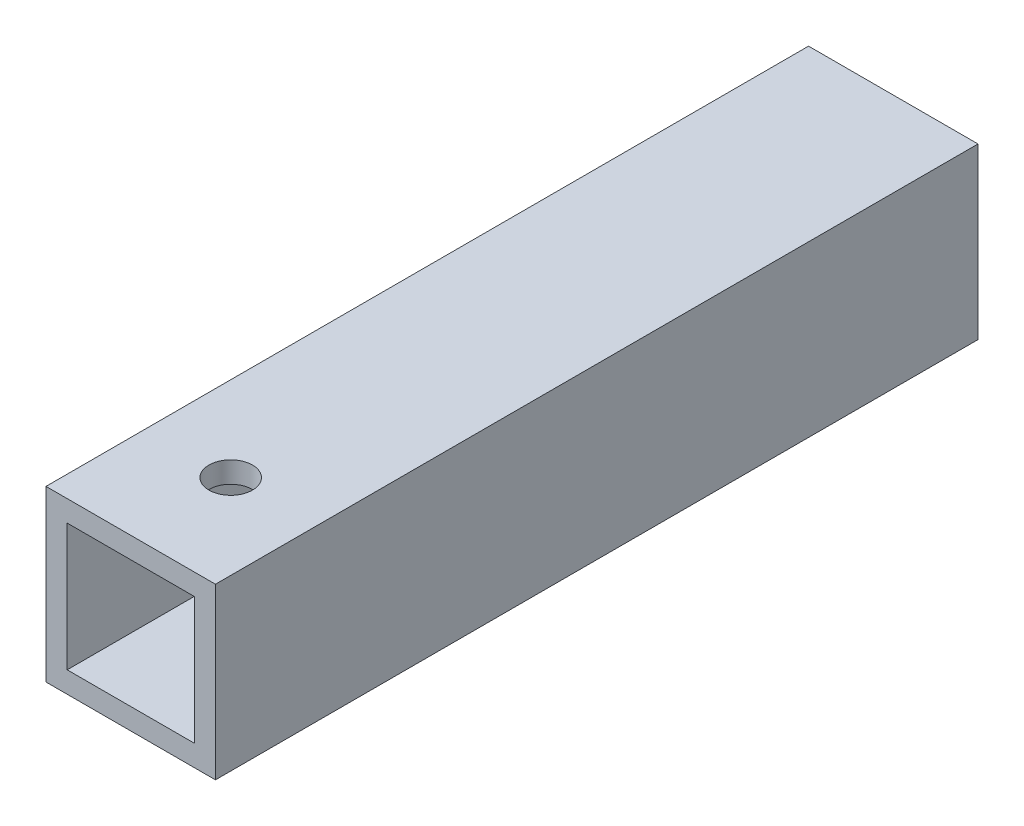
from build123d import *

# Parameters (mm, degrees)
SKETCH1_W           = 25.4
SKETCH1_H           = 25.4
BOSS_EXTRUDE1_DEPTH = 114.3
SKETCH2_W           = 19.05
SKETCH2_H           = 19.05
CUT_EXTRUDE1_DEPTH  = 116.702506455
SKETCH3_R           = 3.2639
CUT_EXTRUDE2_DEPTH  = 118.774954893


with BuildPart() as part:
    # Sketch1 → Boss-Extrude1 (new body)
    with BuildSketch(Plane.XY):
        Rectangle(SKETCH1_W, SKETCH1_H)
    extrude(amount=BOSS_EXTRUDE1_DEPTH)

    # Sketch2 → Cut-Extrude1 (cut, through all)
    with BuildSketch(Plane.XY):
        Rectangle(SKETCH2_W, SKETCH2_H)
    extrude(amount=CUT_EXTRUDE1_DEPTH, mode=Mode.SUBTRACT)

    # Sketch3 → Cut-Extrude2 (cut, through all)
    with BuildSketch(Plane(origin=(0, 12.7, 0), x_dir=(1, 0, 0), z_dir=(0, 1, 0))):
        with Locations((0, -99.314)):
            Circle(SKETCH3_R)
    extrude(amount=-CUT_EXTRUDE2_DEPTH, mode=Mode.SUBTRACT)


solid = part.part
